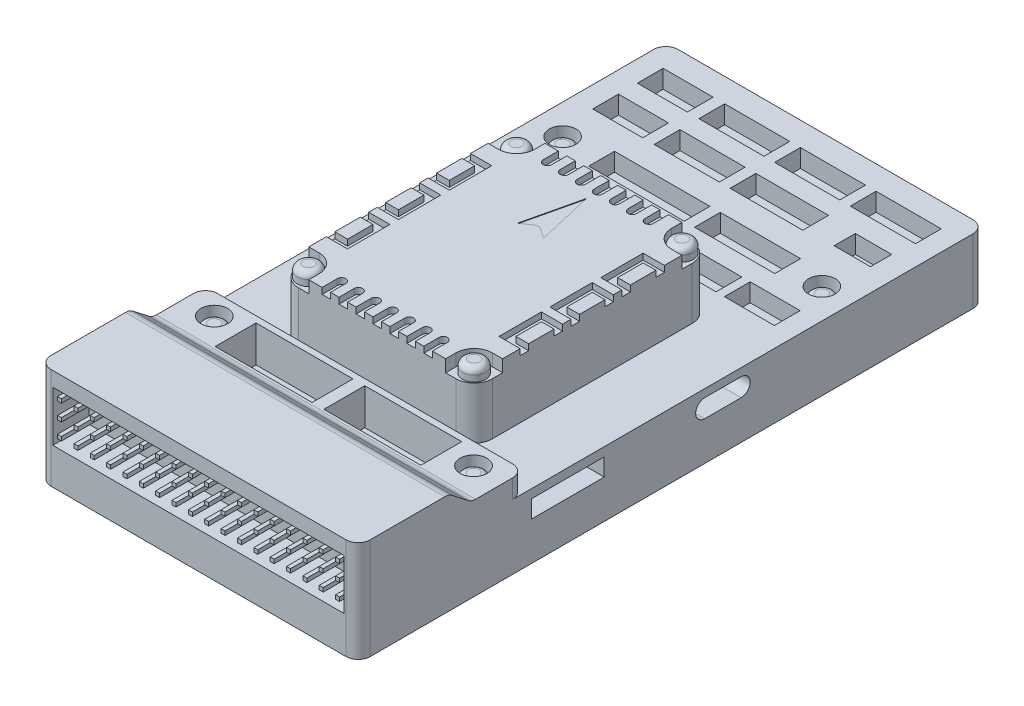
from build123d import *

# Parameters (mm, degrees)
BOSS_EXTRUDE1_DEPTH      = 26.35
SKETCH3_W                = 32
SKETCH3_H                = 39
BOSS_EXTRUDE2_DEPTH      = 10.6
SKETCH4_W                = 9.2
SKETCH4_H                = 5.5
SKETCH4_W_2              = 11.4
SKETCH4_W_3              = 12.7
SKETCH4_W_4              = 7.5
SKETCH4_W_5              = 16.38
SKETCH4_W_6              = 13.85
SKETCH4_W_7              = 8.8
SKETCH4_W_8              = 17
CUT_EXTRUDE1_DEPTH       = 3
SKETCH5_W                = 16.65
SKETCH5_H                = 7.6
CUT_EXTRUDE2_DEPTH       = 6
SKETCH6_W                = 48.1
SKETCH6_H                = 8.3
CUT_EXTRUDE3_DEPTH       = 6
SKETCH7_W                = 0.65
SKETCH7_H                = 0.65
BOSS_EXTRUDE3_DEPTH      = 6
SKETCH8_W                = 13.3
SKETCH8_H                = 3.3
CUT_EXTRUDE4_DEPTH       = 5
SKETCH9_W                = 13.25
SKETCH9_H                = 3.2
CUT_EXTRUDE5_DEPTH       = 5
SKETCH10_R               = 1.25
CUT_EXTRUDE6_DEPTH       = 3
SKETCH11_R               = 2.2
CUT_EXTRUDE7_DEPTH       = 3
FILLET1_R                = 2
FILLET2_R                = 3
CUT_EXTRUDE8_DEPTH       = 1
SKETCH13_W               = 6.3
SKETCH13_H               = 7
SKETCH13_W_2             = 3.5
SKETCH13_H_2             = 4.2
CUT_EXTRUDE9_DEPTH       = 1
CUT_EXTRUDE10_DEPTH      = 62.855274634
CUT_EXTRUDE10_DEPTH_BACK = 2
SKETCH15_R               = 1.9
BOSS_EXTRUDE4_DEPTH      = 2
FILLET3_R                = 1
SKETCH17_R               = 2.2
CUT_EXTRUDE11_DEPTH      = 3
SKETCH18_R               = 2.2
CUT_EXTRUDE12_DEPTH      = 3
SKETCH19_R               = 1.9
BOSS_EXTRUDE5_DEPTH      = 2
SKETCH20_R               = 1.9
BOSS_EXTRUDE6_DEPTH      = 2
FILLET4_R                = 1
CUT_EXTRUDE13_DEPTH      = 0.1
SKETCH22_W               = 9.2
SKETCH22_H               = 5.5
SKETCH22_W_2             = 8.25
SKETCH22_H_2             = 4.25
SKETCH22_W_3             = 8.8
SKETCH22_W_4             = 11.4
SKETCH22_W_5             = 10.75
SKETCH22_W_6             = 12.7
SKETCH22_W_7             = 12
SKETCH22_W_8             = 16.38
SKETCH22_W_9             = 15.75
SKETCH22_W_10            = 13.85
SKETCH22_W_11            = 13.25
SKETCH22_W_12            = 17
SKETCH22_H_3             = 0.625
SKETCH22_W_13            = 7.5
SKETCH22_W_14            = 6
SKETCH22_H_4             = 3.5
BOSS_EXTRUDE7_DEPTH      = 3
SKETCH24_W               = 13.25
SKETCH24_H               = 3.2
SKETCH24_W_2             = 12
SKETCH24_H_2             = 2.9
BOSS_EXTRUDE8_DEPTH      = 5
SKETCH25_W               = 13.3
SKETCH25_H               = 3.3
SKETCH25_W_2             = 12
SKETCH25_H_2             = 2.9
BOSS_EXTRUDE9_DEPTH      = 5
SKETCH26_W               = 16.65
SKETCH26_H               = 7.6
SKETCH26_W_2             = 16
SKETCH26_H_2             = 6.75
BOSS_EXTRUDE10_DEPTH     = 6


with BuildPart() as part:
    # Sketch2 → Boss-Extrude1 (new, symmetric)
    with BuildSketch(Plane(origin=(0, 0, 0), x_dir=(0, 0, -1), z_dir=(1, 0, 0))):
        Polygon((-51.75, 0), (51.75, 0), (51.75, 10.7), (-24.25, 10.7), (-24.25, 13.8), (-33.05, 13.8), (-36.75, 16.7), (-51.75, 16.7), align=None)
    extrude(amount=BOSS_EXTRUDE1_DEPTH, both=True)

    # Sketch3 → Boss-Extrude2 (add)
    with BuildSketch(Plane(origin=(0, 10.7, 0), x_dir=(1, 0, 0), z_dir=(0, 1, 0))):
        with Locations((0, -2.75)):
            Rectangle(SKETCH3_W, SKETCH3_H)
    extrude(amount=BOSS_EXTRUDE2_DEPTH)

    # Sketch4 → Cut-Extrude1 (cut)
    with BuildSketch(Plane(origin=(0, 10.7, 0), x_dir=(1, 0, 0), z_dir=(0, 1, 0))):
        with Locations((-18.75, 45.7)):
            Rectangle(SKETCH4_W, SKETCH4_H)
        with Locations((-7.35, 45.7)):
            Rectangle(SKETCH4_W_2, SKETCH4_H)
        with Locations((5.15, 45.7)):
            Rectangle(SKETCH4_W_2, SKETCH4_H)
        with Locations((17.65, 45.7)):
            Rectangle(SKETCH4_W_2, SKETCH4_H)
        with Locations((-18.75, 38.325711436)):
            Rectangle(SKETCH4_W, SKETCH4_H)
        with Locations((-7.35, 38.325711436)):
            Rectangle(SKETCH4_W_2, SKETCH4_H)
        with Locations((5.8, 38.325711436)):
            Rectangle(SKETCH4_W_3, SKETCH4_H)
        with Locations((19.6, 38.325711436)):
            Rectangle(SKETCH4_W_4, SKETCH4_H)
        with Locations((-7.16, 29.825711436)):
            Rectangle(SKETCH4_W_5, SKETCH4_H)
        with Locations((9.055, 29.825711436)):
            Rectangle(SKETCH4_W_6, SKETCH4_H)
        with Locations((-18.95, 22.360180271)):
            Rectangle(SKETCH4_W_7, SKETCH4_H)
        with Locations((-9.05, 22.360180271)):
            Rectangle(SKETCH4_W_7, SKETCH4_H)
        with Locations((4.95, 22.360180271)):
            Rectangle(SKETCH4_W_8, SKETCH4_H)
        with Locations((18.95, 22.360180271)):
            Rectangle(SKETCH4_W_7, SKETCH4_H)
    extrude(amount=-CUT_EXTRUDE1_DEPTH, mode=Mode.SUBTRACT)

    # Sketch5 → Cut-Extrude2 (cut)
    with BuildSketch(Plane(origin=(0, 13.8, 0), x_dir=(1, 0, 0), z_dir=(0, 1, 0))):
        with Locations((-8.975, -28.65)):
            Rectangle(SKETCH5_W, SKETCH5_H)
        with Locations((8.975, -28.65)):
            Rectangle(SKETCH5_W, SKETCH5_H)
    extrude(amount=-CUT_EXTRUDE2_DEPTH, mode=Mode.SUBTRACT)

    # Sketch6 → Cut-Extrude3 (cut)
    with BuildSketch(Plane.XY.offset(51.75)):
        with Locations((0, 10.15)):
            Rectangle(SKETCH6_W, SKETCH6_H)
    extrude(amount=-CUT_EXTRUDE3_DEPTH, mode=Mode.SUBTRACT)

    # Sketch7 → Boss-Extrude3 (add)
    with BuildSketch(Plane.XY.offset(45.75)):
        with Locations((-22.943198273, 13.056709451)):
            Rectangle(SKETCH7_W, SKETCH7_H)
        with Locations((-20.243198273, 13.056709451)):
            Rectangle(SKETCH7_W, SKETCH7_H)
        with Locations((-17.543198273, 13.056709451)):
            Rectangle(SKETCH7_W, SKETCH7_H)
        with Locations((-14.843198273, 13.056709451)):
            Rectangle(SKETCH7_W, SKETCH7_H)
        with Locations((-12.143198273, 13.056709451)):
            Rectangle(SKETCH7_W, SKETCH7_H)
        with Locations((-9.443198273, 13.056709451)):
            Rectangle(SKETCH7_W, SKETCH7_H)
        with Locations((-6.743198273, 13.056709451)):
            Rectangle(SKETCH7_W, SKETCH7_H)
        with Locations((-4.043198273, 13.056709451)):
            Rectangle(SKETCH7_W, SKETCH7_H)
        with Locations((-1.343198273, 13.056709451)):
            Rectangle(SKETCH7_W, SKETCH7_H)
        with Locations((1.356801727, 13.056709451)):
            Rectangle(SKETCH7_W, SKETCH7_H)
        with Locations((4.056801727, 13.056709451)):
            Rectangle(SKETCH7_W, SKETCH7_H)
        with Locations((6.756801727, 13.056709451)):
            Rectangle(SKETCH7_W, SKETCH7_H)
        with Locations((9.456801727, 13.056709451)):
            Rectangle(SKETCH7_W, SKETCH7_H)
        with Locations((12.156801727, 13.056709451)):
            Rectangle(SKETCH7_W, SKETCH7_H)
        with Locations((14.856801727, 13.056709451)):
            Rectangle(SKETCH7_W, SKETCH7_H)
        with Locations((17.556801727, 13.056709451)):
            Rectangle(SKETCH7_W, SKETCH7_H)
        with Locations((20.256801727, 13.056709451)):
            Rectangle(SKETCH7_W, SKETCH7_H)
        with Locations((22.956801727, 13.056709451)):
            Rectangle(SKETCH7_W, SKETCH7_H)
        with Locations((-20.243198273, 10.356709451)):
            Rectangle(SKETCH7_W, SKETCH7_H)
        with Locations((-17.543198273, 10.356709451)):
            Rectangle(SKETCH7_W, SKETCH7_H)
        with Locations((-14.843198273, 10.356709451)):
            Rectangle(SKETCH7_W, SKETCH7_H)
        with Locations((-12.143198273, 10.356709451)):
            Rectangle(SKETCH7_W, SKETCH7_H)
        with Locations((-9.443198273, 10.356709451)):
            Rectangle(SKETCH7_W, SKETCH7_H)
        with Locations((-6.743198273, 10.356709451)):
            Rectangle(SKETCH7_W, SKETCH7_H)
        with Locations((-4.043198273, 10.356709451)):
            Rectangle(SKETCH7_W, SKETCH7_H)
        with Locations((-1.343198273, 10.356709451)):
            Rectangle(SKETCH7_W, SKETCH7_H)
        with Locations((1.356801727, 10.356709451)):
            Rectangle(SKETCH7_W, SKETCH7_H)
        with Locations((4.056801727, 10.356709451)):
            Rectangle(SKETCH7_W, SKETCH7_H)
        with Locations((6.756801727, 10.356709451)):
            Rectangle(SKETCH7_W, SKETCH7_H)
        with Locations((9.456801727, 10.356709451)):
            Rectangle(SKETCH7_W, SKETCH7_H)
        with Locations((12.156801727, 10.356709451)):
            Rectangle(SKETCH7_W, SKETCH7_H)
        with Locations((14.856801727, 10.356709451)):
            Rectangle(SKETCH7_W, SKETCH7_H)
        with Locations((17.556801727, 10.356709451)):
            Rectangle(SKETCH7_W, SKETCH7_H)
        with Locations((20.256801727, 10.356709451)):
            Rectangle(SKETCH7_W, SKETCH7_H)
        with Locations((22.956801727, 10.356709451)):
            Rectangle(SKETCH7_W, SKETCH7_H)
        with Locations((-20.243198273, 7.656709451)):
            Rectangle(SKETCH7_W, SKETCH7_H)
        with Locations((-17.543198273, 7.656709451)):
            Rectangle(SKETCH7_W, SKETCH7_H)
        with Locations((-14.843198273, 7.656709451)):
            Rectangle(SKETCH7_W, SKETCH7_H)
        with Locations((-12.143198273, 7.656709451)):
            Rectangle(SKETCH7_W, SKETCH7_H)
        with Locations((-9.443198273, 7.656709451)):
            Rectangle(SKETCH7_W, SKETCH7_H)
        with Locations((-6.743198273, 7.656709451)):
            Rectangle(SKETCH7_W, SKETCH7_H)
        with Locations((-4.043198273, 7.656709451)):
            Rectangle(SKETCH7_W, SKETCH7_H)
        with Locations((-1.343198273, 7.656709451)):
            Rectangle(SKETCH7_W, SKETCH7_H)
        with Locations((1.356801727, 7.656709451)):
            Rectangle(SKETCH7_W, SKETCH7_H)
        with Locations((4.056801727, 7.656709451)):
            Rectangle(SKETCH7_W, SKETCH7_H)
        with Locations((6.756801727, 7.656709451)):
            Rectangle(SKETCH7_W, SKETCH7_H)
        with Locations((9.456801727, 7.656709451)):
            Rectangle(SKETCH7_W, SKETCH7_H)
        with Locations((12.156801727, 7.656709451)):
            Rectangle(SKETCH7_W, SKETCH7_H)
        with Locations((14.856801727, 7.656709451)):
            Rectangle(SKETCH7_W, SKETCH7_H)
        with Locations((17.556801727, 7.656709451)):
            Rectangle(SKETCH7_W, SKETCH7_H)
        with Locations((20.256801727, 7.656709451)):
            Rectangle(SKETCH7_W, SKETCH7_H)
        with Locations((22.956801727, 7.656709451)):
            Rectangle(SKETCH7_W, SKETCH7_H)
        with Locations((-22.943198273, 10.356709451)):
            Rectangle(SKETCH7_W, SKETCH7_H)
        with Locations((-22.943198273, 7.656709451)):
            Rectangle(SKETCH7_W, SKETCH7_H)
    extrude(amount=BOSS_EXTRUDE3_DEPTH)

    # Sketch8 → Cut-Extrude4 (cut)
    with BuildSketch(Plane.ZY.offset(26.35)):
        with Locations((17.1, 7.75)):
            Rectangle(SKETCH8_W, SKETCH8_H)
    extrude(amount=-CUT_EXTRUDE4_DEPTH, mode=Mode.SUBTRACT)

    # Sketch9 → Cut-Extrude5 (cut)
    with BuildSketch(Plane(origin=(26.35, 0, 0), x_dir=(0, 0, -1), z_dir=(1, 0, 0))):
        with Locations((-17.125, 7.8)):
            Rectangle(SKETCH9_W, SKETCH9_H)
        with BuildLine():
            Line((5.47, 9.4), (11.47, 9.4))
            ThreePointArc((11.47, 9.4), (12.97, 7.9), (11.47, 6.4))
            Line((11.47, 6.4), (5.47, 6.4))
            ThreePointArc((5.47, 6.4), (3.97, 7.9), (5.47, 9.4))
        make_face()
    extrude(amount=-CUT_EXTRUDE5_DEPTH, mode=Mode.SUBTRACT)

    # Sketch10 → Cut-Extrude6 (cut)
    with BuildSketch(Plane.XZ):
        with Locations(Location((-21.4, 27.75, 0), (0, 0, 270))):
            Circle(SKETCH10_R)
        with Locations(Location((21.4, 27.75, 0), (0, 0, 270))):
            Circle(SKETCH10_R)
        with Locations(Location((21.4, -29.75, 0), (0, 0, 270))):
            Circle(SKETCH10_R)
        with Locations(Location((-21.4, -29.75, 0), (0, 0, 270))):
            Circle(SKETCH10_R)
    extrude(amount=-CUT_EXTRUDE6_DEPTH, mode=Mode.SUBTRACT)

    # Sketch11 → Cut-Extrude7 (cut)
    with BuildSketch(Plane.XZ):
        with Locations(Location((-12.25, 17.75, 0), (0, 0, 270))):
            Circle(SKETCH11_R)
        with Locations(Location((12.25, 17.75, 0), (0, 0, 270))):
            Circle(SKETCH11_R)
        with Locations(Location((12.25, -13.75, 0), (0, 0, 270))):
            Circle(SKETCH11_R)
        with Locations(Location((-12.25, -13.75, 0), (0, 0, 270))):
            Circle(SKETCH11_R)
    extrude(amount=-CUT_EXTRUDE7_DEPTH, mode=Mode.SUBTRACT)

    # Fillet1
    # the kernel refuses this fillet: 2 mm, written as the material it adds along each edge
    with BuildSketch(Plane(origin=(-26.35, 13.8, 33.05), x_dir=(0, 0.6168816632266997, 0.7870559151513065), z_dir=(1, 0, 0))) as fillet1_piece_1_section:
        with BuildLine():
            CenterArc((FILLET1_R * 0.345194382558, -FILLET1_R), FILLET1_R, 90, 38.088772881)
            Line((-FILLET1_R * 0.271687280669, -FILLET1_R * 0.212944084849), (0, 0))
            Line((0, 0), (FILLET1_R * 0.345194382558, 0))
        make_face()
    fillet1_piece_1 = extrude(amount=52.7, mode=Mode.PRIVATE)
    fillet1_piece_1 = split(fillet1_piece_1, bisect_by=Plane(origin=(-21.825, 13.886922742, 32.45), z_dir=(0, 0, 1)), keep=Keep.TOP, mode=Mode.PRIVATE)
    add(fillet1_piece_1)
    with BuildSketch(Plane(origin=(-26.35, 13.8, 33.05), x_dir=(0, 0.6168816632266997, 0.7870559151513065), z_dir=(1, 0, 0))) as fillet1_piece_2_section:
        with BuildLine():
            CenterArc((FILLET1_R * 0.345194382558, -FILLET1_R), FILLET1_R, 90, 38.088772881)
            Line((-FILLET1_R * 0.271687280669, -FILLET1_R * 0.212944084849), (0, 0))
            Line((0, 0), (FILLET1_R * 0.345194382558, 0))
        make_face()
    fillet1_piece_2 = extrude(amount=54.425971913, mode=Mode.PRIVATE)
    fillet1_piece_2 = split(fillet1_piece_2, bisect_by=Plane(origin=(-17.3, 13.800613019, 32.427405118), z_dir=(-1, 0, 0)), keep=Keep.TOP, mode=Mode.PRIVATE)
    add(fillet1_piece_2)
    with BuildSketch(Plane(origin=(-28.075971913, 13.8, 33.05), x_dir=(0, 0.6168816632266997, 0.7870559151513065), z_dir=(1, 0, 0))) as fillet1_piece_3_section:
        with BuildLine():
            CenterArc((FILLET1_R * 0.345194382558, -FILLET1_R), FILLET1_R, 90, 38.088772881)
            Line((-FILLET1_R * 0.271687280669, -FILLET1_R * 0.212944084849), (0, 0))
            Line((0, 0), (FILLET1_R * 0.345194382558, 0))
        make_face()
    fillet1_piece_3 = extrude(amount=56.151943826, mode=Mode.PRIVATE)
    fillet1_piece_3 = split(fillet1_piece_3, bisect_by=Plane(origin=(-0.65, 13.800613019, 32.427405118), z_dir=(1, 0, 0)), keep=Keep.TOP, mode=Mode.PRIVATE)
    fillet1_piece_3 = split(fillet1_piece_3, bisect_by=Plane(origin=(0.65, 13.800613019, 32.427405118), z_dir=(-1, 0, 0)), keep=Keep.TOP, mode=Mode.PRIVATE)
    add(fillet1_piece_3)
    with BuildSketch(Plane(origin=(-28.075971913, 13.8, 33.05), x_dir=(0, 0.6168816632266997, 0.7870559151513065), z_dir=(1, 0, 0))) as fillet1_piece_4_section:
        with BuildLine():
            CenterArc((FILLET1_R * 0.345194382558, -FILLET1_R), FILLET1_R, 90, 38.088772881)
            Line((-FILLET1_R * 0.271687280669, -FILLET1_R * 0.212944084849), (0, 0))
            Line((0, 0), (FILLET1_R * 0.345194382558, 0))
        make_face()
    fillet1_piece_4 = extrude(amount=54.425971913, mode=Mode.PRIVATE)
    fillet1_piece_4 = split(fillet1_piece_4, bisect_by=Plane(origin=(17.3, 13.800613019, 32.427405118), z_dir=(1, 0, 0)), keep=Keep.TOP, mode=Mode.PRIVATE)
    add(fillet1_piece_4)
    # the kernel refuses this fillet: 2 mm, written as the material it takes off along each edge
    with BuildSketch(Plane(origin=(28.075971913, 16.7, 36.75), x_dir=(0, 0, 1), z_dir=(-1, 0, 0))) as fillet1_2_piece_1:
        with BuildLine():
            CenterArc((FILLET1_R * 0.345194382558, -FILLET1_R), FILLET1_R, 90, 38.088772881)
            Line((-FILLET1_R * 0.271687280669, -FILLET1_R * 0.212944084849), (0, 0))
            Line((0, 0), (FILLET1_R * 0.345194382558, 0))
        make_face()
    extrude(amount=56.151943826, mode=Mode.SUBTRACT)
    with BuildSketch(Plane(origin=(26.35, -5, -51.75), x_dir=(0, 0, 1), z_dir=(0, 1, 0)), Plane(origin=(-26.35, -5, -51.75), x_dir=(1, 0, 0), z_dir=(0, 1, 0))) as fillet1_2_piece_2:
        with BuildLine():
            CenterArc((FILLET1_R, -FILLET1_R), FILLET1_R, 90, 90)
            Line((0, -FILLET1_R), (0, 0))
            Line((0, 0), (FILLET1_R, 0))
        make_face()
    extrude(amount=20.7, mode=Mode.SUBTRACT)
    with BuildSketch(Plane(origin=(26.35, 21.7, 51.75), x_dir=(0, 0, -1), z_dir=(0, -1, 0)), Plane(origin=(-26.35, 21.7, 51.75), x_dir=(1, 0, 0), z_dir=(0, -1, 0))) as fillet1_2_piece_3:
        with BuildLine():
            CenterArc((FILLET1_R, -FILLET1_R), FILLET1_R, 90, 90)
            Line((0, -FILLET1_R), (0, 0))
            Line((0, 0), (FILLET1_R, 0))
        make_face()
    extrude(amount=26.7, mode=Mode.SUBTRACT)
    with BuildSketch(Plane(origin=(26.35, 10.7, 24.25), x_dir=(0, 0, 1), z_dir=(0, 1, 0)), Plane(origin=(-26.35, 10.7, 24.25), x_dir=(1, 0, 0), z_dir=(0, 1, 0))) as fillet1_2_piece_4:
        with BuildLine():
            CenterArc((FILLET1_R, -FILLET1_R), FILLET1_R, 90, 90)
            Line((0, -FILLET1_R), (0, 0))
            Line((0, 0), (FILLET1_R, 0))
        make_face()
    extrude(amount=8.1, mode=Mode.SUBTRACT)

    # Fillet2
    fillet2_edges = [part.edges().sort_by_distance(p)[0] for p in [
        (-16, 16, -16.75),
        (-16, 16, 22.25),
        (16, 16, 22.25),
        (16, 16, -16.75),
    ]]
    fillet(fillet2_edges, radius=FILLET2_R)

    # Sketch12 → Cut-Extrude8 (cut)
    with BuildSketch(Plane(origin=(0, 21.3, 0), x_dir=(1, 0, 0), z_dir=(0, 1, 0))):
        with BuildLine():
            Line((-7.7, 16.75), (-7.7, 14.25))
            ThreePointArc((-7.7, 14.25), (-8.4, 13.55), (-9.1, 14.25))
            Line((-9.1, 14.25), (-9.1, 16.75))
            ThreePointArc((-9.1, 16.75), (-8.4, 17.45), (-7.7, 16.75))
        make_face()
        with BuildLine():
            Line((-4.9, 16.75), (-4.9, 14.25))
            ThreePointArc((-4.9, 14.25), (-5.6, 13.55), (-6.3, 14.25))
            Line((-6.3, 14.25), (-6.3, 16.75))
            ThreePointArc((-6.3, 16.75), (-5.6, 17.45), (-4.9, 16.75))
        make_face()
        with BuildLine():
            Line((-2.1, 16.75), (-2.1, 14.25))
            ThreePointArc((-2.1, 14.25), (-2.8, 13.55), (-3.5, 14.25))
            Line((-3.5, 14.25), (-3.5, 16.75))
            ThreePointArc((-3.5, 16.75), (-2.8, 17.45), (-2.1, 16.75))
        make_face()
        with BuildLine():
            Line((0.7, 16.75), (0.7, 14.25))
            ThreePointArc((0.7, 14.25), (0, 13.55), (-0.7, 14.25))
            Line((-0.7, 14.25), (-0.7, 16.75))
            ThreePointArc((-0.7, 16.75), (0, 17.45), (0.7, 16.75))
        make_face()
        with BuildLine():
            Line((3.5, 16.75), (3.5, 14.25))
            ThreePointArc((3.5, 14.25), (2.8, 13.55), (2.1, 14.25))
            Line((2.1, 14.25), (2.1, 16.75))
            ThreePointArc((2.1, 16.75), (2.8, 17.45), (3.5, 16.75))
        make_face()
        with BuildLine():
            Line((6.3, 16.75), (6.3, 14.25))
            ThreePointArc((6.3, 14.25), (5.6, 13.55), (4.9, 14.25))
            Line((4.9, 14.25), (4.9, 16.75))
            ThreePointArc((4.9, 16.75), (5.6, 17.45), (6.3, 16.75))
        make_face()
        with BuildLine():
            Line((9.1, 16.75), (9.1, 14.25))
            ThreePointArc((9.1, 14.25), (8.4, 13.55), (7.7, 14.25))
            Line((7.7, 14.25), (7.7, 16.75))
            ThreePointArc((7.7, 16.75), (8.4, 17.45), (9.1, 16.75))
        make_face()
        with BuildLine():
            Line((-7.7, -22.25), (-7.7, -19.75))
            ThreePointArc((-7.7, -19.75), (-8.4, -19.05), (-9.1, -19.75))
            Line((-9.1, -19.75), (-9.1, -22.25))
            ThreePointArc((-9.1, -22.25), (-8.4, -22.95), (-7.7, -22.25))
        make_face()
        with BuildLine():
            Line((-4.9, -22.25), (-4.9, -19.75))
            ThreePointArc((-4.9, -19.75), (-5.6, -19.05), (-6.3, -19.75))
            Line((-6.3, -19.75), (-6.3, -22.25))
            ThreePointArc((-6.3, -22.25), (-5.6, -22.95), (-4.9, -22.25))
        make_face()
        with BuildLine():
            Line((-2.1, -22.25), (-2.1, -19.75))
            ThreePointArc((-2.1, -19.75), (-2.8, -19.05), (-3.5, -19.75))
            Line((-3.5, -19.75), (-3.5, -22.25))
            ThreePointArc((-3.5, -22.25), (-2.8, -22.95), (-2.1, -22.25))
        make_face()
        with BuildLine():
            Line((0.7, -22.25), (0.7, -19.75))
            ThreePointArc((0.7, -19.75), (0, -19.05), (-0.7, -19.75))
            Line((-0.7, -19.75), (-0.7, -22.25))
            ThreePointArc((-0.7, -22.25), (0, -22.95), (0.7, -22.25))
        make_face()
        with BuildLine():
            Line((3.5, -22.25), (3.5, -19.75))
            ThreePointArc((3.5, -19.75), (2.8, -19.05), (2.1, -19.75))
            Line((2.1, -19.75), (2.1, -22.25))
            ThreePointArc((2.1, -22.25), (2.8, -22.95), (3.5, -22.25))
        make_face()
        with BuildLine():
            Line((6.3, -22.25), (6.3, -19.75))
            ThreePointArc((6.3, -19.75), (5.6, -19.05), (4.9, -19.75))
            Line((4.9, -19.75), (4.9, -22.25))
            ThreePointArc((4.9, -22.25), (5.6, -22.95), (6.3, -22.25))
        make_face()
        with BuildLine():
            Line((9.1, -22.25), (9.1, -19.75))
            ThreePointArc((9.1, -19.75), (8.4, -19.05), (7.7, -19.75))
            Line((7.7, -19.75), (7.7, -22.25))
            ThreePointArc((7.7, -22.25), (8.4, -22.95), (9.1, -22.25))
        make_face()
    extrude(amount=-CUT_EXTRUDE8_DEPTH, mode=Mode.SUBTRACT)

    # Sketch13 → Cut-Extrude9 (cut)
    # profile 1 of 6: a face of its own
    with BuildSketch(Plane(origin=(0, 21.3, 0), x_dir=(1, 0, 0), z_dir=(0, 1, 0))):
        with Locations((-15.65, 5.65)):
            Rectangle(SKETCH13_W, SKETCH13_H)
        with Locations((-15.65, 5.65)):
            Rectangle(SKETCH13_W_2, SKETCH13_H_2, mode=Mode.SUBTRACT)
    # profile 2 of 6: a face of its own
    with BuildSketch(Plane(origin=(0, 21.3, 0), x_dir=(1, 0, 0), z_dir=(0, 1, 0))):
        with Locations((-15.65, -2.75)):
            Rectangle(SKETCH13_W, SKETCH13_H)
        with Locations((-15.65, -2.75)):
            Rectangle(SKETCH13_W_2, SKETCH13_H_2, mode=Mode.SUBTRACT)
    # profile 3 of 6: a face of its own
    with BuildSketch(Plane(origin=(0, 21.3, 0), x_dir=(1, 0, 0), z_dir=(0, 1, 0))):
        with Locations((-15.65, -11.15)):
            Rectangle(SKETCH13_W, SKETCH13_H)
        with Locations((-15.65, -11.15)):
            Rectangle(SKETCH13_W_2, SKETCH13_H_2, mode=Mode.SUBTRACT)
    # profile 4 of 6: a face of its own
    with BuildSketch(Plane(origin=(0, 21.3, 0), x_dir=(1, 0, 0), z_dir=(0, 1, 0))):
        with Locations((15.65, -11.15)):
            Rectangle(SKETCH13_W, SKETCH13_H)
        with Locations((15.65, -11.15)):
            Rectangle(SKETCH13_W_2, SKETCH13_H_2, mode=Mode.SUBTRACT)
    # profile 5 of 6: a face of its own
    with BuildSketch(Plane(origin=(0, 21.3, 0), x_dir=(1, 0, 0), z_dir=(0, 1, 0))):
        with Locations((15.65, -2.75)):
            Rectangle(SKETCH13_W, SKETCH13_H)
        with Locations((15.65, -2.75)):
            Rectangle(SKETCH13_W_2, SKETCH13_H_2, mode=Mode.SUBTRACT)
    # profile 6 of 6: a face of its own
    with BuildSketch(Plane(origin=(0, 21.3, 0), x_dir=(1, 0, 0), z_dir=(0, 1, 0))):
        with Locations((15.65, 5.65)):
            Rectangle(SKETCH13_W, SKETCH13_H)
        with Locations((15.65, 5.65)):
            Rectangle(SKETCH13_W_2, SKETCH13_H_2, mode=Mode.SUBTRACT)
    extrude(amount=-CUT_EXTRUDE9_DEPTH, mode=Mode.SUBTRACT)

    # Sketch14 → Cut-Extrude10 (cut, two sides: drawn at the far end of the back side and taken through both)
    with BuildSketch(Plane(origin=(0, 21.3, 0), x_dir=(1, 0, 0), z_dir=(0, 1, 0)).offset(-CUT_EXTRUDE10_DEPTH_BACK)):
        with BuildLine():
            Line((-16, 12.05), (-14.3, 12.05))
            ThreePointArc((-14.3, 12.05), (-12.178679656, 12.928679656), (-11.3, 15.05))
            Line((-11.3, 15.05), (-11.3, 16.75))
            Line((-11.3, 16.75), (-13, 16.75))
            ThreePointArc((-13, 16.75), (-15.121320344, 15.871320344), (-16, 13.75))
            Line((-16, 13.75), (-16, 12.05))
        make_face()
        with BuildLine():
            Line((11.3, 15.05), (11.3, 16.75))
            Line((11.3, 16.75), (13, 16.75))
            ThreePointArc((13, 16.75), (15.121320344, 15.871320344), (16, 13.75))
            Line((16, 13.75), (16, 12.05))
            Line((16, 12.05), (14.3, 12.05))
            ThreePointArc((14.3, 12.05), (12.178679656, 12.928679656), (11.3, 15.05))
        make_face()
        with BuildLine():
            Line((16, -17.55), (14.3, -17.55))
            ThreePointArc((14.3, -17.55), (12.178679656, -18.428679656), (11.3, -20.55))
            Line((11.3, -20.55), (11.3, -22.25))
            Line((11.3, -22.25), (13, -22.25))
            ThreePointArc((13, -22.25), (15.121320344, -21.371320344), (16, -19.25))
            Line((16, -19.25), (16, -17.55))
        make_face()
        with BuildLine():
            Line((-11.3, -20.55), (-11.3, -22.25))
            Line((-11.3, -22.25), (-13, -22.25))
            ThreePointArc((-13, -22.25), (-15.121320344, -21.371320344), (-16, -19.25))
            Line((-16, -19.25), (-16, -17.55))
            Line((-16, -17.55), (-14.3, -17.55))
            ThreePointArc((-14.3, -17.55), (-12.178679656, -18.428679656), (-11.3, -20.55))
        make_face()
    extrude(amount=CUT_EXTRUDE10_DEPTH + CUT_EXTRUDE10_DEPTH_BACK, mode=Mode.SUBTRACT)

    # Sketch15 → Boss-Extrude4 (add)
    with BuildSketch(Plane(origin=(0, 19.3, 0), x_dir=(1, 0, 0), z_dir=(0, 1, 0))):
        with Locations(Location((-13.65, -19.9, 0), (0, 0, 270))):
            Circle(SKETCH15_R)
        with Locations(Location((13.65, -19.9, 0), (0, 0, 90))):
            Circle(SKETCH15_R)
        with Locations(Location((13.65, 14.4, 0), (0, 0, 270))):
            Circle(SKETCH15_R)
        with Locations(Location((-13.65, 14.4, 0), (0, 0, 90))):
            Circle(SKETCH15_R)
    extrude(amount=BOSS_EXTRUDE4_DEPTH)

    # Fillet3
    fillet3_edges = [part.edges().sort_by_distance(p)[0] for p in [
        (-13.65, 21.3, 18),
        (13.65, 21.3, 21.8),
        (13.65, 21.3, -16.3),
        (-13.65, 21.3, -12.5),
    ]]
    fillet(fillet3_edges, radius=FILLET3_R)

    # Sketch17 → Cut-Extrude11 (cut)
    with BuildSketch(Plane(origin=(0, 13.8, 0), x_dir=(1, 0, 0), z_dir=(0, 1, 0))):
        with Locations(Location((-21.4, -27.75, 0), (0, 0, 270))):
            Circle(SKETCH17_R)
        with Locations(Location((21.4, -27.75, 0), (0, 0, 270))):
            Circle(SKETCH17_R)
        with Locations((21.4, 29.75)):
            Circle(SKETCH17_R)
        with Locations((-21.4, 29.75)):
            Circle(SKETCH17_R)
    extrude(amount=-CUT_EXTRUDE11_DEPTH, mode=Mode.SUBTRACT)

    # Sketch18 → Cut-Extrude12 (cut)
    with BuildSketch(Plane(origin=(0, 10.7, 0), x_dir=(1, 0, 0), z_dir=(0, 1, 0))):
        with Locations(Location((-21.4, 29.75, 0), (0, 0, 270))):
            Circle(SKETCH18_R)
        with Locations(Location((21.4, 29.75, 0), (0, 0, 270))):
            Circle(SKETCH18_R)
    extrude(amount=-CUT_EXTRUDE12_DEPTH, mode=Mode.SUBTRACT)

    # Sketch19 → Boss-Extrude5 (add)
    with BuildSketch(Plane(origin=(0, 7.7, 0), x_dir=(1, 0, 0), z_dir=(0, 1, 0))):
        with Locations(Location((-21.4, 29.75, 0), (0, 0, 270))):
            Circle(SKETCH19_R)
        with Locations(Location((21.4, 29.75, 0), (0, 0, 270))):
            Circle(SKETCH19_R)
    extrude(amount=BOSS_EXTRUDE5_DEPTH)

    # Sketch20 → Boss-Extrude6 (add)
    with BuildSketch(Plane(origin=(0, 10.8, 0), x_dir=(1, 0, 0), z_dir=(0, 1, 0))):
        with Locations(Location((-21.4, -27.75, 0), (0, 0, 270))):
            Circle(SKETCH20_R)
        with Locations(Location((21.4, -27.75, 0), (0, 0, 270))):
            Circle(SKETCH20_R)
    extrude(amount=BOSS_EXTRUDE6_DEPTH)

    # Fillet4
    fillet4_edges = [part.edges().sort_by_distance(p)[0] for p in [
        (-21.4, 9.7, -31.65),
        (21.4, 9.7, -31.65),
        (-21.4, 12.8, 25.85),
        (21.4, 12.8, 25.85),
    ]]
    fillet(fillet4_edges, radius=FILLET4_R)

    # Sketch21 → Cut-Extrude13 (cut)
    with BuildSketch(Plane(origin=(0, 21.3, 0), x_dir=(1, 0, 0), z_dir=(0, 1, 0))):
        with BuildLine():
            Line((0, 12.276769849), (-2.15, 3.076769849))
            Line((-2.15, 3.076769849), (-0.561046089, 4.153712348))
            ThreePointArc((-0.561046089, 4.153712348), (0, 4.325927783), (0.561046089, 4.153712348))
            Line((0.561046089, 4.153712348), (2.15, 3.076769849))
            Line((2.15, 3.076769849), (0, 12.276769849))
        make_face()
    extrude(amount=-CUT_EXTRUDE13_DEPTH, mode=Mode.SUBTRACT)

    # Sketch22 → Boss-Extrude7 (add)
    # profile 1 of 15: a face of its own
    with BuildSketch(Plane(origin=(0, 7.7, 0), x_dir=(1, 0, 0), z_dir=(0, 1, 0))):
        with Locations((-18.75, 45.7)):
            Rectangle(SKETCH22_W, SKETCH22_H)
        with Locations((-18.75, 45.7)):
            Rectangle(SKETCH22_W_2, SKETCH22_H_2, mode=Mode.SUBTRACT)
    # profile 2 of 15: a face of its own
    with BuildSketch(Plane(origin=(0, 7.7, 0), x_dir=(1, 0, 0), z_dir=(0, 1, 0))):
        with Locations((-18.75, 38.325711436)):
            Rectangle(SKETCH22_W, SKETCH22_H)
        with Locations((-18.75, 38.325711436)):
            Rectangle(SKETCH22_W_2, SKETCH22_H_2, mode=Mode.SUBTRACT)
    # profile 3 of 15: a face of its own
    with BuildSketch(Plane(origin=(0, 7.7, 0), x_dir=(1, 0, 0), z_dir=(0, 1, 0))):
        with Locations((-18.95, 22.360180271)):
            Rectangle(SKETCH22_W_3, SKETCH22_H)
        with Locations((-18.95, 22.360180271)):
            Rectangle(SKETCH22_W_2, SKETCH22_H_2, mode=Mode.SUBTRACT)
    # profile 4 of 15: a face of its own
    with BuildSketch(Plane(origin=(0, 7.7, 0), x_dir=(1, 0, 0), z_dir=(0, 1, 0))):
        with Locations((-7.35, 45.7)):
            Rectangle(SKETCH22_W_4, SKETCH22_H)
        with Locations((-7.35, 45.7)):
            Rectangle(SKETCH22_W_5, SKETCH22_H_2, mode=Mode.SUBTRACT)
    # profile 5 of 15: a face of its own
    with BuildSketch(Plane(origin=(0, 7.7, 0), x_dir=(1, 0, 0), z_dir=(0, 1, 0))):
        with Locations((5.15, 45.7)):
            Rectangle(SKETCH22_W_4, SKETCH22_H)
        with Locations((5.15, 45.7)):
            Rectangle(SKETCH22_W_5, SKETCH22_H_2, mode=Mode.SUBTRACT)
    # profile 6 of 15: a face of its own
    with BuildSketch(Plane(origin=(0, 7.7, 0), x_dir=(1, 0, 0), z_dir=(0, 1, 0))):
        with Locations((17.65, 45.7)):
            Rectangle(SKETCH22_W_4, SKETCH22_H)
        with Locations((17.65, 45.7)):
            Rectangle(SKETCH22_W_5, SKETCH22_H_2, mode=Mode.SUBTRACT)
    # profile 7 of 15: a face of its own
    with BuildSketch(Plane(origin=(0, 7.7, 0), x_dir=(1, 0, 0), z_dir=(0, 1, 0))):
        with Locations((-7.35, 38.325711436)):
            Rectangle(SKETCH22_W_4, SKETCH22_H)
        with Locations((-7.35, 38.325711436)):
            Rectangle(SKETCH22_W_5, SKETCH22_H_2, mode=Mode.SUBTRACT)
    # profile 8 of 15: a face of its own
    with BuildSketch(Plane(origin=(0, 7.7, 0), x_dir=(1, 0, 0), z_dir=(0, 1, 0))):
        with Locations((5.8, 38.325711436)):
            Rectangle(SKETCH22_W_6, SKETCH22_H)
        with Locations((5.8, 38.325711436)):
            Rectangle(SKETCH22_W_7, SKETCH22_H_2, mode=Mode.SUBTRACT)
    # profile 9 of 15: a face of its own
    with BuildSketch(Plane(origin=(0, 7.7, 0), x_dir=(1, 0, 0), z_dir=(0, 1, 0))):
        with Locations((-7.16, 29.825711436)):
            Rectangle(SKETCH22_W_8, SKETCH22_H)
        with Locations((-7.16, 29.825711436)):
            Rectangle(SKETCH22_W_9, SKETCH22_H_2, mode=Mode.SUBTRACT)
    # profile 10 of 15: a face of its own
    with BuildSketch(Plane(origin=(0, 7.7, 0), x_dir=(1, 0, 0), z_dir=(0, 1, 0))):
        with Locations((9.055, 29.825711436)):
            Rectangle(SKETCH22_W_10, SKETCH22_H)
        with Locations((9.055, 29.825711436)):
            Rectangle(SKETCH22_W_11, SKETCH22_H_2, mode=Mode.SUBTRACT)
    # profile 11 of 15: a face of its own
    with BuildSketch(Plane(origin=(0, 7.7, 0), x_dir=(1, 0, 0), z_dir=(0, 1, 0))):
        with Locations((-9.05, 22.360180271)):
            Rectangle(SKETCH22_W_3, SKETCH22_H)
        with Locations((-9.05, 22.360180271)):
            Rectangle(SKETCH22_W_2, SKETCH22_H_2, mode=Mode.SUBTRACT)
    # profile 12 of 15: a face of its own
    with BuildSketch(Plane(origin=(0, 7.7, 0), x_dir=(1, 0, 0), z_dir=(0, 1, 0))):
        with Locations((4.95, 24.797680271)):
            Rectangle(SKETCH22_W_12, SKETCH22_H_3)
    # profile 13 of 15: a face of its own
    with BuildSketch(Plane(origin=(0, 7.7, 0), x_dir=(1, 0, 0), z_dir=(0, 1, 0))):
        with Locations((18.95, 22.360180271)):
            Rectangle(SKETCH22_W_3, SKETCH22_H)
        with Locations((18.95, 22.360180271)):
            Rectangle(SKETCH22_W_2, SKETCH22_H_2, mode=Mode.SUBTRACT)
    # profile 14 of 15: a face of its own
    with BuildSketch(Plane(origin=(0, 7.7, 0), x_dir=(1, 0, 0), z_dir=(0, 1, 0))):
        with Locations((4.95, 19.922680271)):
            Rectangle(SKETCH22_W_12, SKETCH22_H_3)
    # profile 15 of 15: a face of its own
    with BuildSketch(Plane(origin=(0, 7.7, 0), x_dir=(1, 0, 0), z_dir=(0, 1, 0))):
        with Locations((19.6, 38.325711436)):
            Rectangle(SKETCH22_W_13, SKETCH22_H)
        with Locations((19.6, 38.325711436)):
            Rectangle(SKETCH22_W_14, SKETCH22_H_4, mode=Mode.SUBTRACT)
    extrude(amount=BOSS_EXTRUDE7_DEPTH)

    # Sketch24 → Boss-Extrude8 (add)
    with BuildSketch(Plane(origin=(21.35, 0, 0), x_dir=(0, 0, -1), z_dir=(1, 0, 0))):
        with Locations((-17.125, 7.8)):
            Rectangle(SKETCH24_W, SKETCH24_H)
        with Locations((-17.125, 7.8)):
            Rectangle(SKETCH24_W_2, SKETCH24_H_2, mode=Mode.SUBTRACT)
    extrude(amount=BOSS_EXTRUDE8_DEPTH)

    # Sketch25 → Boss-Extrude9 (add)
    with BuildSketch(Plane.ZY.offset(21.35)):
        with Locations((17.1, 7.75)):
            Rectangle(SKETCH25_W, SKETCH25_H)
        with Locations((17.1, 7.75)):
            Rectangle(SKETCH25_W_2, SKETCH25_H_2, mode=Mode.SUBTRACT)
    extrude(amount=BOSS_EXTRUDE9_DEPTH)

    # Sketch26 → Boss-Extrude10 (add)
    # profile 1 of 2: a face of its own
    with BuildSketch(Plane(origin=(0, 7.8, 0), x_dir=(1, 0, 0), z_dir=(0, 1, 0))):
        with Locations((-8.975, -28.65)):
            Rectangle(SKETCH26_W, SKETCH26_H)
        with Locations((-8.975, -28.65)):
            Rectangle(SKETCH26_W_2, SKETCH26_H_2, mode=Mode.SUBTRACT)
    # profile 2 of 2: a face of its own
    with BuildSketch(Plane(origin=(0, 7.8, 0), x_dir=(1, 0, 0), z_dir=(0, 1, 0))):
        with Locations((8.975, -28.65)):
            Rectangle(SKETCH26_W, SKETCH26_H)
        with Locations((8.975, -28.65)):
            Rectangle(SKETCH26_W_2, SKETCH26_H_2, mode=Mode.SUBTRACT)
    extrude(amount=BOSS_EXTRUDE10_DEPTH)


solid = part.part
